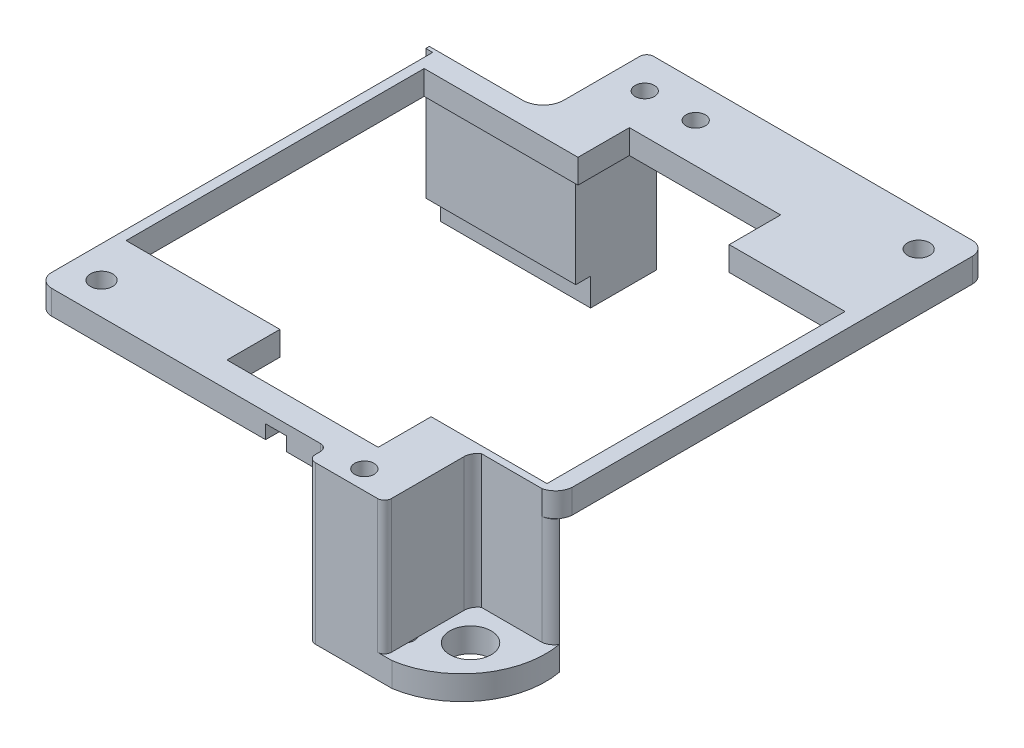
from build123d import *

# Parameters (mm, degrees)
SKETCH2_R           = 1.4
SKETCH2_R_2         = 1.6
BOSS_EXTRUDE1_DEPTH = 3.5
SKETCH3_R           = 1.4
BOSS_EXTRUDE2_DEPTH = 15.8
SKETCH4_R           = 3
SKETCH4_R_2         = 1.5
BOSS_EXTRUDE3_DEPTH = 3.5
SKETCH5_W           = 3
SKETCH5_H           = 3.708496363
BOSS_EXTRUDE4_DEPTH = 1.5
SKETCH7_W           = 35.498397003
SKETCH7_H           = 12.144188448
CUT_EXTRUDE2_DEPTH  = 4
BOSS_EXTRUDE5_DEPTH = 1
SKETCH6_W           = 15.172785082
SKETCH6_H           = 14.006435155
CUT_EXTRUDE3_DEPTH  = 15
CHAMFER1_START      = -11.4
CHAMFER1_DEPTH      = 0.087265638
CHAMFER1_START_2    = -35.5
CHAMFER1_2_DEPTH    = 3
CHAMFER1_START_3    = -11.312734362
CHAMFER1_3_DEPTH    = 7.312734362


with BuildPart() as part:
    # Sketch2 → Boss-Extrude1 (new body)
    with BuildSketch(Plane.XZ.offset(-3.6)):
        with BuildLine():
            Line((11.111566046, -27.048023457), (11.111566046, -19.6))
            Line((11.111566046, -19.6), (27.9, -19.6))
            Line((27.9, -19.6), (27.9, 23.6))
            Line((27.9, 23.6), (11.111563156, 23.6))
            Line((11.111563156, 23.6), (11.111563156, 31.276925258))
            Line((11.111563156, 31.276925258), (1.5, 31.276925258))
            Line((1.5, 31.276925258), (1.5, 34.985421621))
            Line((1.5, 34.985421621), (6.463917188, 34.985421621))
            ThreePointArc((6.463917188, 34.985421621), (7.171023969, 35.278314839), (7.463917188, 35.985421621))
            Line((7.463917188, 35.985421621), (7.463917188, 36.75))
            ThreePointArc((7.463917188, 36.75), (7.756810407, 37.457106781), (8.463917188, 37.75))
            Line((8.463917188, 37.75), (17.5, 37.75))
            ThreePointArc((17.5, 37.75), (18.207106781, 37.457106781), (18.5, 36.75))
            Line((18.5, 36.75), (18.5, 26.25))
            ThreePointArc((18.5, 26.25), (18.73500033, 25.309374588), (19.384776166, 24.589796458))
            Line((19.384776166, 24.589796458), (28.192260407, 24.589796458))
            ThreePointArc((28.192260407, 24.589796458), (29.567455824, 23.740606822), (30.192257213, 22.25))
            Line((30.192257213, 22.25), (30.192257213, -35.750098385))
            ThreePointArc((30.192257213, -35.750098385), (29.606435992, -37.164248347), (28.192257213, -37.75))
            Line((28.192257213, -37.75), (-18, -37.75))
            ThreePointArc((-18, -37.75), (-18.707106781, -37.457106781), (-19, -36.75))
            Line((-19, -36.75), (-19, -25.75))
            ThreePointArc((-19, -25.75), (-19.878679656, -23.628679656), (-22, -22.75))
            Line((-22, -22.75), (-32.5, -22.75))
            ThreePointArc((-32.5, -22.75), (-33.207106781, -23.042893219), (-33.5, -23.75))
            Line((-33.5, -23.75), (-33.5, -27.662734362))
            ThreePointArc((-33.5, -27.662734362), (-33.792893219, -28.369841143), (-34.5, -28.662734362))
            Line((-34.5, -28.662734362), (-34.5, 32.985421621))
            ThreePointArc((-34.5, 32.985421621), (-33.914213562, 34.399635183), (-32.5, 34.985421621))
            Line((-32.5, 34.985421621), (-1.5, 34.985421621))
            Line((-1.5, 34.985421621), (-1.5, 31.276925258))
            Line((-1.5, 31.276925258), (-10.808436895, 31.276925258))
            Line((-10.808436895, 31.276925258), (-10.808436895, 23.6))
            Line((-10.808436895, 23.6), (-33.1, 23.6))
            Line((-33.1, 23.6), (-33.1, -19.6))
            Line((-33.1, -19.6), (-10.808436895, -19.6))
            Line((-10.808436895, -19.6), (-10.808436895, -27.048023457))
            Line((-10.808436895, -27.048023457), (11.111566046, -27.048023457))
        make_face()
        with Locations(Location((-6.918752516, -32.76626587, 0), (0, 0, 270))):
            Circle(SKETCH2_R, mode=Mode.SUBTRACT)
        with Locations(Location((25.4, -32.76626587, 0), (0, 0, 270))):
            Circle(SKETCH2_R_2, mode=Mode.SUBTRACT)
        with Locations(Location((-14.297096298, -32.76626587, 0), (0, 0, 270))):
            Circle(SKETCH2_R, mode=Mode.SUBTRACT)
        with Locations(Location((-29.911917882, 30.347920192, 0), (0, 0, 270))):
            Circle(SKETCH2_R_2, mode=Mode.SUBTRACT)
        with Locations(Location((12.814585658, 34.985421621, 0), (0, 0, 270))):
            Circle(SKETCH2_R, mode=Mode.SUBTRACT)
    extrude(amount=BOSS_EXTRUDE1_DEPTH)

    # Sketch3 → Boss-Extrude2 (add)
    # profile 1 of 2: a face of its own
    with BuildSketch(Plane(origin=(0, 0.1, 0), x_dir=(-1, 0, 0), z_dir=(0, -1, 0))):
        with BuildLine():
            Line((-7.463917188, -33.985421621), (-7.463917188, -36.75))
            ThreePointArc((-7.463917188, -36.75), (-7.756810407, -37.457106781), (-8.463917188, -37.75))
            Line((-8.463917188, -37.75), (-17.5, -37.75))
            ThreePointArc((-17.5, -37.75), (-18.207106781, -37.457106781), (-18.5, -36.75))
            Line((-18.5, -36.75), (-18.5, -26.25))
            ThreePointArc((-18.5, -26.25), (-18.73500033, -25.309374588), (-19.384776166, -24.589796458))
            Line((-19.384776166, -24.589796458), (-28.192260407, -24.589796458))
            ThreePointArc((-28.192260407, -24.589796458), (-29.052595302, -24.270206108), (-29.679602398, -23.6))
            Line((-29.679602398, -23.6), (-11.111563156, -23.6))
            Line((-11.111563156, -23.6), (-11.111563156, -24.25))
            Line((-11.111563156, -24.25), (-11.111563156, -33.985421621))
            Line((-11.111563156, -33.985421621), (-7.463917188, -33.985421621))
        make_face()
        with Locations(Location((-12.814585658, -34.985421621, 0), (0, 0, 90))):
            Circle(SKETCH3_R, mode=Mode.SUBTRACT)
    # profile 2 of 2: a face of its own
    with BuildSketch(Plane(origin=(0, 0.1, 0), x_dir=(-1, 0, 0), z_dir=(0, -1, 0))):
        with BuildLine():
            Line((13.774855788, 22.239537014), (34.5, 22.239537014))
            Line((34.5, 22.239537014), (34.5, 23.75))
            Line((34.5, 23.75), (34.5, 28.662734362))
            ThreePointArc((34.5, 28.662734362), (33.792893219, 28.369841143), (33.5, 27.662734362))
            Line((33.5, 27.662734362), (33.5, 23.75))
            ThreePointArc((33.5, 23.75), (33.207106781, 23.042893219), (32.5, 22.75))
            Line((32.5, 22.75), (22, 22.75))
            ThreePointArc((22, 22.75), (20.777489524, 23.010389054), (19.767197945, 23.746354576))
            ThreePointArc((19.767197945, 23.746354576), (19.198357074, 24.67724797), (19, 25.75))
            Line((19, 25.75), (19, 33.953406826))
            Line((19, 33.953406826), (13.774855788, 33.953406826))
            Line((13.774855788, 33.953406826), (13.774855788, 31.467318277))
            Line((13.774855788, 31.467318277), (13.774855788, 23.746354576))
            Line((13.774855788, 23.746354576), (13.774855788, 22.239537014))
        make_face()
    extrude(amount=BOSS_EXTRUDE2_DEPTH)

    # Sketch4 → Boss-Extrude3 (add)
    # profile 1 of 2: a face of its own
    with BuildSketch(Plane.XZ.offset(15.7)):
        with BuildLine():
            Line((11.111563156, 23.6), (29.679602398, 23.6))
            ThreePointArc((29.679602398, 23.6), (27.614927524, 32.806940788), (19.577713664, 37.75))
            Line((19.577713664, 37.75), (8.463917188, 37.75))
            ThreePointArc((8.463917188, 37.75), (7.756810407, 37.457106781), (7.463917188, 36.75))
            Line((7.463917188, 36.75), (7.463917188, 33.985421621))
            Line((7.463917188, 33.985421621), (11.111563156, 33.985421621))
            Line((11.111563156, 33.985421621), (11.111563156, 23.6))
        make_face()
        with Locations(Location((23.040610867, 29.824211278, 0), (0, 0, 270))):
            Circle(SKETCH4_R, mode=Mode.SUBTRACT)
        with Locations(Location((17.180435895, 33.650043419, 0), (0, 0, 28.392671192))):
            Circle(SKETCH4_R_2, mode=Mode.SUBTRACT)
    # profile 2 of 2: a face of its own
    with BuildSketch(Plane.XZ.offset(15.7)):
        with BuildLine():
            Line((-29.84427835, -33.953406826), (-13.774855788, -33.953406826))
            Line((-13.774855788, -33.953406826), (-13.774855788, -22.239537014))
            Line((-13.774855788, -22.239537014), (-34.5, -22.239537014))
            Line((-34.5, -22.239537014), (-34.5, -28.662734362))
            ThreePointArc((-34.5, -28.662734362), (-32.451529424, -31.553930311), (-29.84427835, -33.953406826))
        make_face()
        with Locations(Location((-23.956564477, -27.796810843, 0), (0, 0, 270))):
            Circle(SKETCH4_R, mode=Mode.SUBTRACT)
        with Locations(Location((-30.707720306, -27.953239531, 0), (0, 0, 270))):
            Circle(SKETCH4_R_2, mode=Mode.SUBTRACT)
    extrude(amount=BOSS_EXTRUDE3_DEPTH)

    # Sketch5 → Boss-Extrude4 (add)
    with BuildSketch(Plane(origin=(0, 3.6, 0), x_dir=(1, 0, 0), z_dir=(0, 1, 0))):
        with Locations((0, -33.13117344)):
            Rectangle(SKETCH5_W, SKETCH5_H)
    extrude(amount=-BOSS_EXTRUDE4_DEPTH)

    # Sketch7 → Cut-Extrude2 (cut)
    with BuildSketch(Plane.XZ.offset(19.2)):
        with Locations((-20.871227876, -18.320079155)):
            Rectangle(SKETCH7_W, SKETCH7_H)
    extrude(amount=-CUT_EXTRUDE2_DEPTH, mode=Mode.SUBTRACT)

    # Sketch8 → Boss-Extrude5 (add)
    with BuildSketch(Plane.ZY.offset(34.5)):
        Polygon((-24.392173379, -19.2), (-24.392173379, -15.2), (-22.239537014, -15.2), (-22.239537014, 0.1), (-22.239537014, 3.6), (-28.662734362, 3.6), (-28.662734362, -19.2), align=None)
    extrude(amount=BOSS_EXTRUDE5_DEPTH)

    # Sketch6 → Cut-Extrude3 (cut)
    with BuildSketch(Plane(origin=(0, 3.6, 0), x_dir=(1, 0, 0), z_dir=(0, 1, 0))):
        with Locations((-37.568827946, 29.753217578)):
            Rectangle(SKETCH6_W, SKETCH6_H)
    extrude(amount=-CUT_EXTRUDE3_DEPTH, mode=Mode.SUBTRACT)

    # Chamfer1: read off the stored shape, not the designer's step
    # Chamfer1 outline → Chamfer1 (add)
    with BuildSketch(Plane(origin=(0, 0, 0), x_dir=(1, 0, 0), z_dir=(0, 1, 0)).offset(CHAMFER1_START)):
        with BuildLine():
            Line((-33.5, 23.75), (-33.5, 27.662734362))
            ThreePointArc((-33.5, 27.662734362), (-33.792893219, 28.369841143), (-34.5, 28.662734362))
            Line((-34.5, 28.662734362), (-35.5, 28.662734362))
            Line((-35.5, 28.662734362), (-35.5, 22.75))
            Line((-35.5, 22.75), (-32.5, 22.75))
            ThreePointArc((-32.5, 22.75), (-33.207106781, 23.042893219), (-33.5, 23.75))
        make_face()
    extrude(amount=CHAMFER1_DEPTH)

    # Chamfer1 2 outline → Chamfer1 2 (add)
    with BuildSketch(Plane.YZ.offset(CHAMFER1_START_2)):
        Polygon((-11.312734362, -28.662734362), (-5.4, -22.75), (-11.312734362, -22.75), align=None)
    extrude(amount=CHAMFER1_2_DEPTH)

    # Chamfer1 3 outline → Chamfer1 3 (cut)
    with BuildSketch(Plane(origin=(0, 0, 0), x_dir=(1, 0, 0), z_dir=(0, 1, 0)).offset(CHAMFER1_START_3)):
        with BuildLine():
            ThreePointArc((-34.5, 28.662734362), (-33.792893219, 28.369841143), (-33.5, 27.662734362))
            Line((-33.5, 27.662734362), (-33.5, 23.75))
            ThreePointArc((-33.5, 23.75), (-33.207106781, 23.042893219), (-32.5, 22.75))
            Line((-32.5, 22.75), (-32.5, 30))
            Line((-32.5, 30), (-36, 30))
            Line((-36, 30), (-36, 28.662734363))
            Line((-36, 28.662734363), (-34.5, 28.662734362))
        make_face()
    extrude(amount=CHAMFER1_3_DEPTH, mode=Mode.SUBTRACT)


solid = part.part
